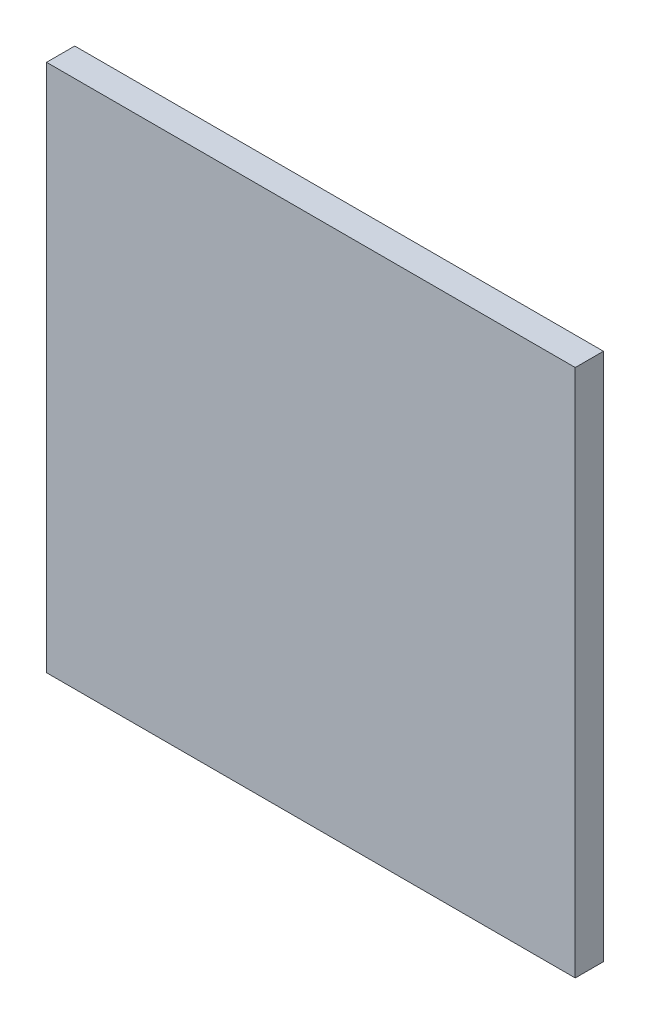
from build123d import *

# Parameters (mm, degrees)
SKETCH_1_W             = 300
SKETCH_1_H             = 300
SM_BASE_FLANGE_1_DEPTH = 16


# Sheet-metal steps are written as plain solids
with BuildPart() as part:
    # Sketch 1 → Базовая кромка1 (new body)
    with BuildSketch(Plane.XY):
        with Locations((150, -150)):
            Rectangle(SKETCH_1_W, SKETCH_1_H)
    extrude(amount=-SM_BASE_FLANGE_1_DEPTH)


solid = part.part
